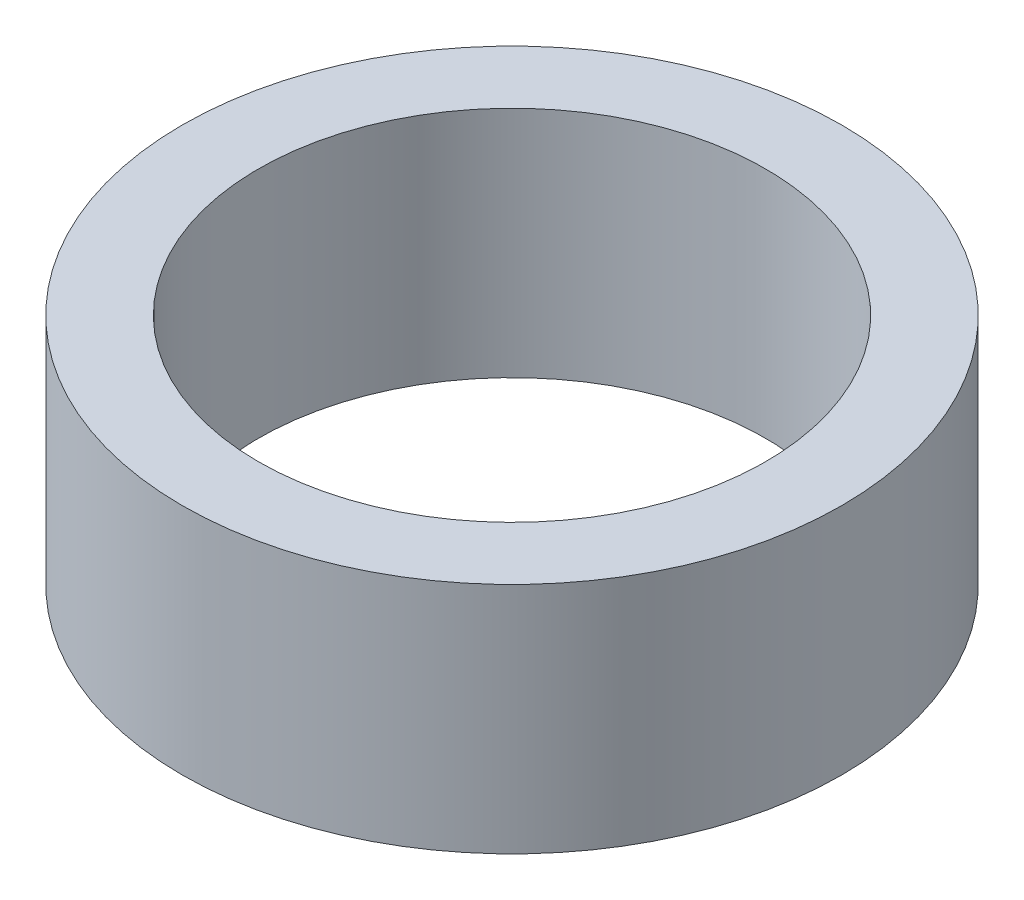
from build123d import *

# Parameters (mm, degrees)
SKETCH1_R           = 32.5
BOSS_EXTRUDE1_DEPTH = 23
SKETCH2_R           = 25
CUT_EXTRUDE1_DEPTH  = 52.395525097


with BuildPart() as part:
    # Sketch1 → Boss-Extrude1 (new body)
    with BuildSketch(Plane(origin=(0, 0, 0), x_dir=(1, 0, 0), z_dir=(0, 1, 0))):
        Circle(SKETCH1_R)
    extrude(amount=BOSS_EXTRUDE1_DEPTH)

    # Sketch2 → Cut-Extrude1 (cut, through all)
    with BuildSketch(Plane(origin=(0, 0, 0), x_dir=(1, 0, 0), z_dir=(0, 1, 0))):
        Circle(SKETCH2_R)
    extrude(amount=CUT_EXTRUDE1_DEPTH, mode=Mode.SUBTRACT)


solid = part.part
